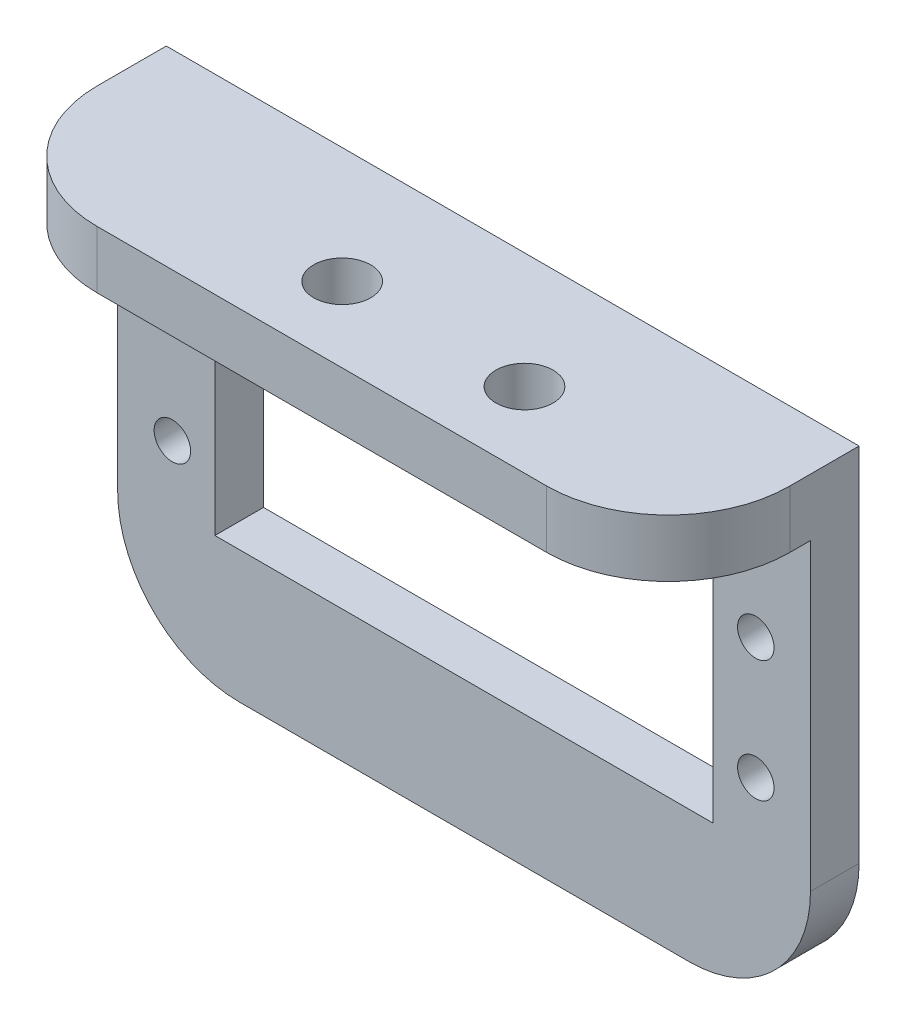
from build123d import *

# Parameters (mm, degrees)
SKETCH1_W           = 57
SKETCH1_H           = 35
SKETCH1_R           = 1.5
SKETCH1_W_2         = 41
SKETCH1_H_2         = 20
BASE_FLANGE2_DEPTH  = 4
EDGE_FLANGE1_DEPTH  = 57
FILLET1_R           = 10
SKETCH22_R          = 2.35
CUT_EXTRUDE4_DEPTH  = 10
SKETCH17_W          = 57
SKETCH17_H          = 15.7
BOSS_EXTRUDE1_DEPTH = 4.7366
SKETCH25_R          = 2.35
CUT_EXTRUDE5_DEPTH  = 51.280586508
FILLET2_R           = 10


# Sheet-metal steps are written as plain solids
with BuildPart() as part:
    # Sketch1 → Base-Flange2 (new body)
    with BuildSketch(Plane.XY):
        with Locations((0, -3.36)):
            Rectangle(SKETCH1_W, SKETCH1_H)
        with Locations((-24, 5)):
            Circle(SKETCH1_R, mode=Mode.SUBTRACT)
        with Locations(Location((24, 5, 0), (0, 0, 180))):
            Circle(SKETCH1_R, mode=Mode.SUBTRACT)
        with Locations((24, -5)):
            Circle(SKETCH1_R, mode=Mode.SUBTRACT)
        with Locations(Location((-24, -5, 0), (0, 0, 180))):
            Circle(SKETCH1_R, mode=Mode.SUBTRACT)
        Rectangle(SKETCH1_W_2, SKETCH1_H_2, mode=Mode.SUBTRACT)
    extrude(amount=-BASE_FLANGE2_DEPTH)

    # Edge-Flange1 section (across the edge) → Edge-Flange1 (add)
    with BuildSketch(Plane(origin=(28.5, 14.8766, 0), x_dir=(0, -1, 0), z_dir=(-1, 0, 0))):
        with BuildLine():
            Line((-4, 0.7366), (-4, 11.7))
            Line((-4, 11.7), (0, 11.7))
            Line((0, 11.7), (0, 0.7366))
            ThreePointArc((0, 0.7366), (0.215745145, 0.215745145), (0.7366, 0))
            Line((0.7366, 0), (0.7366, -4))
            ThreePointArc((0.7366, -4), (-2.61268198, -2.61268198), (-4, 0.7366))
        make_face()
    extrude(amount=EDGE_FLANGE1_DEPTH)

    # Fillet1
    fillet1_edges = [part.edges().sort_by_distance(p)[0] for p in [
        (28.5, 16.8766, 11.7),
        (-28.5, 16.8766, 11.7),
        (28.5, -20.86, -2),
        (-28.5, -20.86, -2),
    ]]
    fillet(fillet1_edges, radius=FILLET1_R)

    # Sketch22 → Cut-Extrude4 (cut)
    with BuildSketch(Plane(origin=(0, 18.8766, 0), x_dir=(1, 0, 0), z_dir=(0, 1, 0))):
        with Locations(Location((-4.5, -5.521282453, 0), (0, 0, 270))):
            Circle(SKETCH22_R)
        with Locations(Location((10.5, -5.521282453, 0), (0, 0, 270))):
            Circle(SKETCH22_R)
    extrude(amount=-CUT_EXTRUDE4_DEPTH, mode=Mode.SUBTRACT)

    # Sketch17 → Boss-Extrude1 (add)
    with BuildSketch(Plane(origin=(0, 18.8766, 0), x_dir=(1, 0, 0), z_dir=(0, 1, 0))):
        with Locations((0, -3.85)):
            Rectangle(SKETCH17_W, SKETCH17_H)
    extrude(amount=-BOSS_EXTRUDE1_DEPTH)

    # Sketch25 → Cut-Extrude5 (cut, through all)
    with BuildSketch(Plane(origin=(0, 18.8766, 0), x_dir=(1, 0, 0), z_dir=(0, 1, 0))):
        with Locations(Location((-4.5, -5.53, 0), (0, 0, 270))):
            Circle(SKETCH25_R)
        with Locations(Location((10.5, -5.53, 0), (0, 0, 270))):
            Circle(SKETCH25_R)
    extrude(amount=-CUT_EXTRUDE5_DEPTH, mode=Mode.SUBTRACT)

    # Fillet2
    fillet2_edges = [part.edges().sort_by_distance(p)[0] for p in [
        (-28.5, 16.5083, 11.7),
        (28.5, 16.5083, 11.7),
    ]]
    fillet(fillet2_edges, radius=FILLET2_R)


solid = part.part
